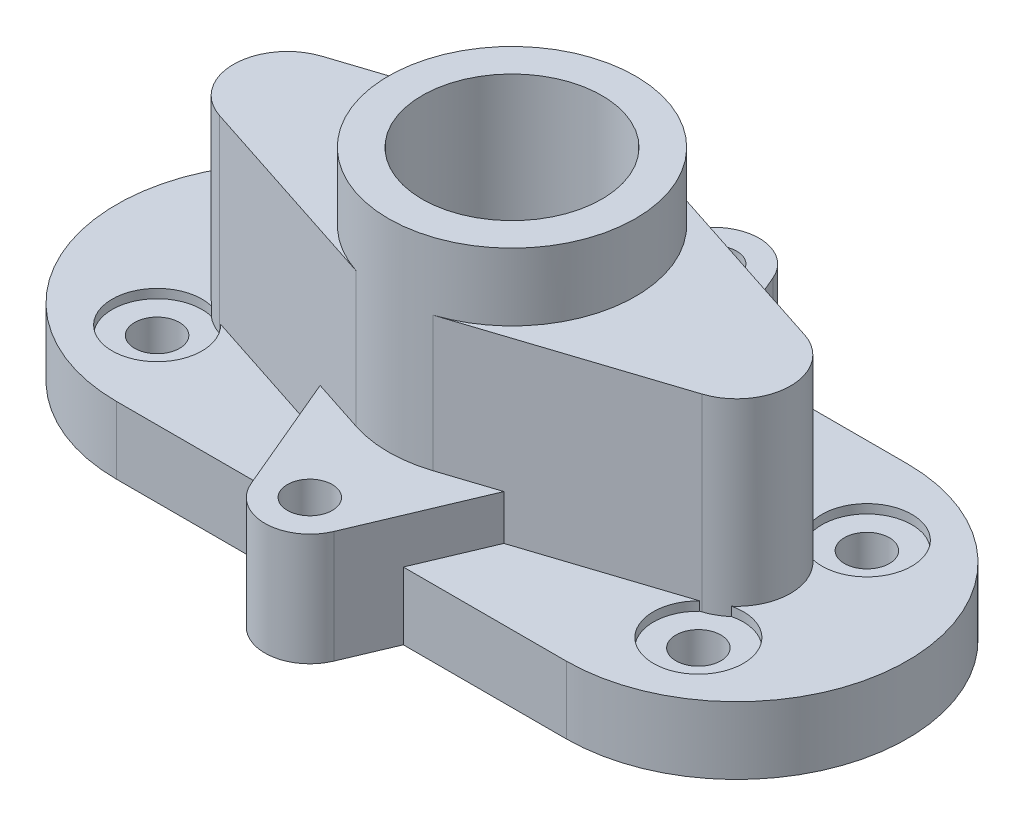
from build123d import *

# Parameters (mm, degrees)
SKETCH1_R           = 5
BOSS_EXTRUDE2_DEPTH = 15
CUT_EXTRUDE1_START  = -2
SKETCH2_R           = 10
SKETCH2_R_2         = 5
CUT_EXTRUDE1_DEPTH  = 2
BOSS_EXTRUDE3_START = -15
SKETCH3_R           = 5
BOSS_EXTRUDE3_DEPTH = 25
BOSS_EXTRUDE4_DEPTH = 55
SKETCH5_R           = 27.5
BOSS_EXTRUDE5_DEPTH = 15
SKETCH6_R           = 20
CUT_EXTRUDE2_DEPTH  = 126.175931669
EXTRUDE_THIN1_START = 22.5
EXTRUDE_THIN1_DEPTH = 15
BOSS_EXTRUDE6_START = -15
SKETCH8_R           = 10
BOSS_EXTRUDE6_DEPTH = 20
SKETCH9_R           = 5
CUT_EXTRUDE3_DEPTH  = 113.139483989


with BuildPart() as part:
    # Sketch1 → Boss-Extrude2 (new body)
    with BuildSketch(Plane(origin=(0, 0, 0), x_dir=(1, 0, 0), z_dir=(0, 1, 0))):
        with BuildLine():
            Line((-50.077388597, -38), (50.077388597, -38))
            ThreePointArc((50.077388597, -38), (88.000078802, 0), (50.077388597, 38))
            Line((50.077388597, 38), (-50.077388597, 38))
            ThreePointArc((-50.077388597, 38), (-88.000078802, 0), (-50.077388597, -38))
        make_face()
        with Locations(Location((-60.241162363, 18.755220238, 0), (0, 0, 270))):
            Circle(SKETCH1_R, mode=Mode.SUBTRACT)
        with Locations(Location((-60.241162363, -18.755220238, 0), (0, 0, 270))):
            Circle(SKETCH1_R, mode=Mode.SUBTRACT)
        with Locations(Location((60.241162363, -18.755220238, 0), (0, 0, 270))):
            Circle(SKETCH1_R, mode=Mode.SUBTRACT)
        with Locations(Location((60.241162363, 18.755220238, 0), (0, 0, 270))):
            Circle(SKETCH1_R, mode=Mode.SUBTRACT)
    extrude(amount=BOSS_EXTRUDE2_DEPTH)

    # Sketch2 → Cut-Extrude1 (cut)
    # profile 1 of 4: a face of its own
    with BuildSketch(Plane(origin=(0, 15, 0), x_dir=(1, 0, 0), z_dir=(0, 1, 0)).offset(CUT_EXTRUDE1_START)):
        with Locations(Location((-60.241162363, -18.755220238, 0), (0, 0, 270))):
            Circle(SKETCH2_R)
        with Locations(Location((-60.241162363, -18.755220238, 0), (0, 0, 270))):
            Circle(SKETCH2_R_2, mode=Mode.SUBTRACT)
    # profile 2 of 4: a face of its own
    with BuildSketch(Plane(origin=(0, 15, 0), x_dir=(1, 0, 0), z_dir=(0, 1, 0)).offset(CUT_EXTRUDE1_START)):
        with Locations(Location((-60.241162363, 18.755220238, 0), (0, 0, 270))):
            Circle(SKETCH2_R)
        with Locations(Location((-60.241162363, 18.755220238, 0), (0, 0, 270))):
            Circle(SKETCH2_R_2, mode=Mode.SUBTRACT)
    # profile 3 of 4: a face of its own
    with BuildSketch(Plane(origin=(0, 15, 0), x_dir=(1, 0, 0), z_dir=(0, 1, 0)).offset(CUT_EXTRUDE1_START)):
        with Locations(Location((60.241162363, 18.755220238, 0), (0, 0, 270))):
            Circle(SKETCH2_R)
        with Locations(Location((60.241162363, 18.755220238, 0), (0, 0, 270))):
            Circle(SKETCH2_R_2, mode=Mode.SUBTRACT)
    # profile 4 of 4: a face of its own
    with BuildSketch(Plane(origin=(0, 15, 0), x_dir=(1, 0, 0), z_dir=(0, 1, 0)).offset(CUT_EXTRUDE1_START)):
        with Locations(Location((60.241162363, -18.755220238, 0), (0, 0, 90))):
            Circle(SKETCH2_R)
    extrude(amount=CUT_EXTRUDE1_DEPTH, mode=Mode.SUBTRACT)

    # Sketch3 → Boss-Extrude3 (add)
    with BuildSketch(Plane(origin=(0, 15, 0), x_dir=(1, 0, 0), z_dir=(0, 1, 0)).offset(BOSS_EXTRUDE3_START)):
        with BuildLine():
            Line((-9.21284664, 48.888888889), (-25.33532826, 10.694444444))
            ThreePointArc((-25.33532826, 10.694444444), (-27.5, 0), (-25.33532826, -10.694444444))
            Line((-25.33532826, -10.694444444), (-9.21284664, -48.888888889))
            ThreePointArc((-9.21284664, -48.888888889), (0, -55), (9.21284664, -48.888888889))
            Line((9.21284664, -48.888888889), (25.33532826, -10.694444444))
            ThreePointArc((25.33532826, -10.694444444), (27.5, 0), (25.33532826, 10.694444444))
            Line((25.33532826, 10.694444444), (9.21284664, 48.888888889))
            ThreePointArc((9.21284664, 48.888888889), (0, 55), (-9.21284664, 48.888888889))
        make_face()
        with Locations(Location((0, 45, 0), (0, 0, 270))):
            Circle(SKETCH3_R, mode=Mode.SUBTRACT)
        with Locations(Location((0, -45, 0), (0, 0, 270))):
            Circle(SKETCH3_R, mode=Mode.SUBTRACT)
    extrude(amount=BOSS_EXTRUDE3_DEPTH)

    # Sketch4 → Boss-Extrude4 (add)
    with BuildSketch(Plane(origin=(0, 0, 0), x_dir=(1, 0, 0), z_dir=(0, 1, 0))):
        with BuildLine():
            Line((-53.72, 11.408838679), (-8.525, 26.145255306))
            ThreePointArc((-8.525, 26.145255306), (0, 27.5), (8.525, 26.145255306))
            Line((8.525, 26.145255306), (53.72, 11.408838679))
            ThreePointArc((53.72, 11.408838679), (62, 0), (53.72, -11.408838679))
            Line((53.72, -11.408838679), (8.525, -26.145255306))
            ThreePointArc((8.525, -26.145255306), (0, -27.5), (-8.525, -26.145255306))
            Line((-8.525, -26.145255306), (-53.72, -11.408838679))
            ThreePointArc((-53.72, -11.408838679), (-62, 0), (-53.72, 11.408838679))
        make_face()
    extrude(amount=BOSS_EXTRUDE4_DEPTH)

    # Sketch5 → Boss-Extrude5 (add)
    with BuildSketch(Plane(origin=(0, 55, 0), x_dir=(1, 0, 0), z_dir=(0, 1, 0))):
        with Locations(Location((0, 0, 0), (0, 0, 108.059230491))):
            Circle(SKETCH5_R)
    extrude(amount=BOSS_EXTRUDE5_DEPTH)

    # Sketch6 → Cut-Extrude2 (cut, through all)
    with BuildSketch(Plane(origin=(0, 70, 0), x_dir=(1, 0, 0), z_dir=(0, 1, 0))):
        with Locations(Location((0, 0, 0), (0, 0, 270))):
            Circle(SKETCH6_R)
    extrude(amount=-CUT_EXTRUDE2_DEPTH, mode=Mode.SUBTRACT)

    # Extrude-Thin1: read off the stored shape, not the designer's step
    # Extrude-Thin1 outline → Extrude-Thin1 (add)
    with BuildSketch(Plane(origin=(0, 0, 0), x_dir=(1, 0, 0), z_dir=(0, 1, 0)).offset(EXTRUDE_THIN1_START)):
        with BuildLine():
            Line((4, 4), (4, 19.595917942))
            ThreePointArc((4, 19.595917942), (0, 20), (-4, 19.595917942))
            Line((-4, 19.595917942), (-4, 4))
            Line((-4, 4), (-19.595917942, 4))
            ThreePointArc((-19.595917942, 4), (-20, 0), (-19.595917942, -4))
            Line((-19.595917942, -4), (-4, -4))
            Line((-4, -4), (-4, -19.595917942))
            ThreePointArc((-4, -19.595917942), (0, -20), (4, -19.595917942))
            Line((4, -19.595917942), (4, -4))
            Line((4, -4), (19.595917942, -4))
            ThreePointArc((19.595917942, -4), (20, 0), (19.595917942, 4))
            Line((19.595917942, 4), (4, 4))
        make_face()
    extrude(amount=EXTRUDE_THIN1_DEPTH)

    # Sketch8 → Boss-Extrude6 (add)
    with BuildSketch(Plane(origin=(0, 37.5, 0), x_dir=(1, 0, 0), z_dir=(0, 1, 0)).offset(BOSS_EXTRUDE6_START)):
        with Locations(Location((0, 0, 0), (0, 0, 66.421821522))):
            Circle(SKETCH8_R)
    extrude(amount=BOSS_EXTRUDE6_DEPTH)

    # Sketch9 → Cut-Extrude3 (cut, through all)
    with BuildSketch(Plane(origin=(0, 42.5, 0), x_dir=(1, 0, 0), z_dir=(0, 1, 0))):
        with Locations(Location((0, 0, 0), (0, 0, 270))):
            Circle(SKETCH9_R)
    extrude(amount=-CUT_EXTRUDE3_DEPTH, mode=Mode.SUBTRACT)


solid = part.part
